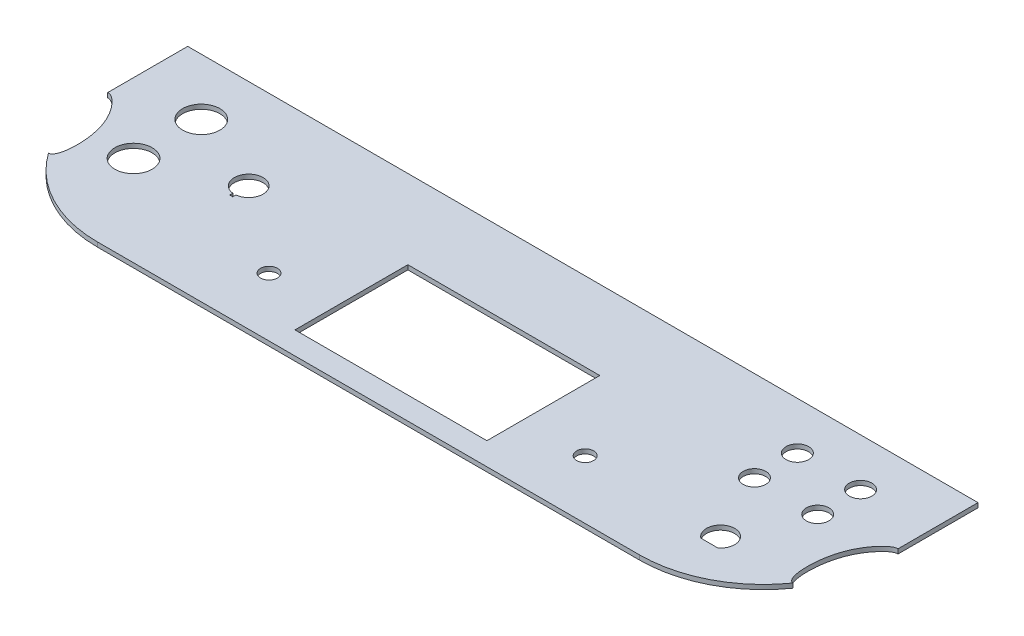
from build123d import *

# Parameters (mm, degrees)
BOSS_EXTRUDE1_DEPTH = 2.54
SKETCH2_W           = 107.95
SKETCH2_H           = 63.5
CUT_EXTRUDE1_DEPTH  = 238.771783963
CUT_EXTRUDE4_REACH  = 239.772
SKETCH4_R           = 6.35
SKETCH4_R_2         = 10.5
SKETCH4_R_3         = 4.7625
CUT_EXTRUDE3_DEPTH  = 238.771784093


with BuildPart() as part:
    # Sketch1 → Boss-Extrude1 (new body)
    with BuildSketch(Plane(origin=(0, 0, 0), x_dir=(1, 0, 0), z_dir=(0, 1, 0))):
        with BuildLine():
            Line((222.25, -14.612459999), (222.25, 36.187540001))
            Line((222.25, 36.187540001), (-222.25, 36.187540001))
            Line((-222.25, 36.187540001), (-222.25, -14.612459999))
            ThreePointArc((-222.25, -14.612459999), (-201.791408666, -64.003868664), (-152.4, -84.462459999))
            Line((-152.4, -84.462459999), (152.4, -84.462459999))
            ThreePointArc((152.4, -84.462459999), (201.791408666, -64.003868664), (222.25, -14.612459999))
        make_face()
    extrude(amount=BOSS_EXTRUDE1_DEPTH)

    # Sketch2 → Cut-Extrude1 (cut, through all)
    with BuildSketch(Plane(origin=(0, 2.54, 0), x_dir=(1, 0, 0), z_dir=(0, 1, 0))):
        with Locations((0, -40.012459999)):
            Rectangle(SKETCH2_W, SKETCH2_H)
    extrude(amount=-CUT_EXTRUDE1_DEPTH, mode=Mode.SUBTRACT)

    # Sketch5 → Cut-Extrude4 (cut, up to next)
    with BuildSketch(Plane(origin=(0, 2.54, 0), x_dir=(1, 0, 0), z_dir=(0, 1, 0)), mode=Mode.PRIVATE) as cut_extrude4_sk1:
        with BuildLine():
            ThreePointArc((-222.25, -14.612459999), (-218.970589391, -35.763798683), (-209.440289817, -54.929055063))
            add(Edge.make_bspline(
                [(-209.440289817, -54.929055063), (-204.823931799, -55.506078622), (-202.304901657, -25.266816537), (-219.26819847, -8.373976847), (-222.25, -8.829558466)],
                knots=[0, 0, 0, 0, 0.32580352, 0.516674914, 0.516674914, 0.516674914, 0.516674914], degree=3))
            Line((-222.25, -8.829558466), (-222.25, -14.612459999))
        make_face()
    cut_extrude4_tool1 = extrude(cut_extrude4_sk1.sketch, amount=-CUT_EXTRUDE4_REACH, mode=Mode.PRIVATE) & part.part
    # Sketch5 → Cut-Extrude4 (cut, up to next)
    with BuildSketch(Plane(origin=(0, 2.54, 0), x_dir=(1, 0, 0), z_dir=(0, 1, 0)), mode=Mode.PRIVATE) as cut_extrude4_sk2:
        with BuildLine():
            add(Edge.make_bspline(
                [(209.440289817, -54.929055063), (204.823931799, -55.506078622), (202.304901657, -25.266816537), (235.136564978, 7.428480335), (216.288594077, -54.073048471), (209.440289817, -54.929055063)],
                knots=[0, 0, 0, 0, 0.32580352, 0.516674914, 1, 1, 1, 1], degree=3))
        make_face()
    cut_extrude4_tool2 = extrude(cut_extrude4_sk2.sketch, amount=-CUT_EXTRUDE4_REACH, mode=Mode.PRIVATE) & part.part
    add(cut_extrude4_tool1.solids().sort_by_distance((-213.6132, 2.54, 31.506825))[0], mode=Mode.SUBTRACT)
    add(cut_extrude4_tool2.solids().sort_by_distance((214.431319, 2.54, 31.263671))[0], mode=Mode.SUBTRACT)

    # Sketch4 → Cut-Extrude3 (cut, through all)
    with BuildSketch(Plane(origin=(0, 2.54, 0), x_dir=(1, 0, 0), z_dir=(0, 1, 0))):
        with Locations((182.88, -14.612459999)):
            Circle(SKETCH4_R)
        with Locations((-182.88, 4.437540001)):
            Circle(SKETCH4_R_2)
        with BuildLine():
            ThreePointArc((-136.31, -22.667737772), (-137.16, -6.512459999), (-138.01, -22.667737772))
            Line((-138.01, -22.667737772), (-138.01, -24.412459999))
            Line((-138.01, -24.412459999), (-136.31, -24.412459999))
            Line((-136.31, -24.412459999), (-136.31, -22.667737772))
        make_face()
        with Locations((-182.88, -33.662459999)):
            Circle(SKETCH4_R_2)
        with Locations((-88.9, -51.442459999)):
            Circle(SKETCH4_R_3)
        with Locations((88.9, -51.442459999)):
            Circle(SKETCH4_R_3)
        with Locations((147.32, 9.517540001)):
            Circle(SKETCH4_R)
        with Locations((147.32, -14.612459999)):
            Circle(SKETCH4_R)
        with BuildLine():
            ThreePointArc((171.1325, -59.062459999), (166.37, -44.774959999), (161.6075, -59.062459999))
            Line((161.6075, -59.062459999), (171.1325, -59.062459999))
        make_face()
        with Locations((182.88, 9.517540001)):
            Circle(SKETCH4_R)
    extrude(amount=-CUT_EXTRUDE3_DEPTH, mode=Mode.SUBTRACT)


solid = part.part
